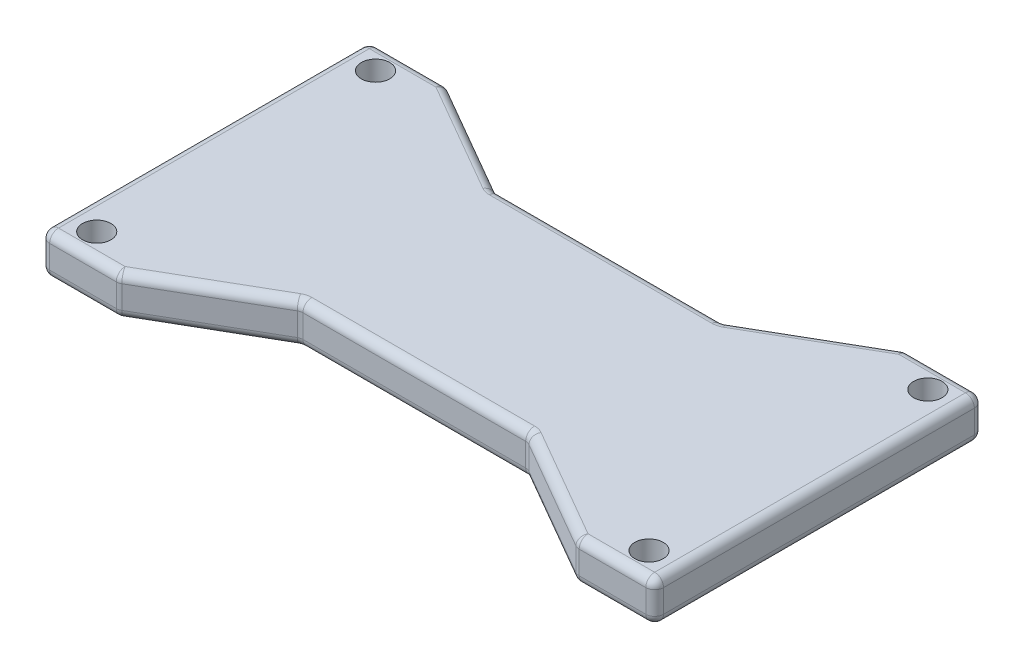
from build123d import *

# Parameters (mm, degrees)
SKETCH3_R           = 2.032000000000001
BOSS_EXTRUDE1_DEPTH = 5.842
FILLET1_R           = 1.27
CHAMFER1_SIZE       = 18.697488468
CHAMFER1_SIZE_2     = 10.795
FILLET2_R           = 1.27


with BuildPart() as part:
    # Sketch3 → Boss-Extrude1 (new body)
    with BuildSketch(Plane(origin=(0, 0, 0), x_dir=(1, 0, 0), z_dir=(0, 1, 0))):
        Polygon((44.531665591536154, -23.494999999999987), (53.467, -23.49499999999999), (53.467, 23.49499999999999), (44.531665591536154, 23.494999999999987), (44.531665591536154, 13.97), (-25.399999999999977, 13.97), (-25.399999999999977, 23.494999999999997), (-34.33533440846382, 23.494999999999997), (-34.33533440846385, -23.494999999999997), (-25.39999999999999, -23.494999999999997), (-25.39999999999999, -13.97), (44.531665591536154, -13.97), align=None)
        with Locations(Location((49.10366559153615, 19.939, 0), (0, 0, 270))):
            Circle(SKETCH3_R, mode=Mode.SUBTRACT)
        with Locations(Location((49.10366559153615, -19.939, 0), (0, 0, 90))):
            Circle(SKETCH3_R, mode=Mode.SUBTRACT)
        with Locations(Location((-29.890334408463843, -19.939000000000004, 0), (0, 0, 270))):
            Circle(SKETCH3_R, mode=Mode.SUBTRACT)
        with Locations(Location((-29.890334408463843, 19.939000000000004, 0), (0, 0, 90))):
            Circle(SKETCH3_R, mode=Mode.SUBTRACT)
    extrude(amount=BOSS_EXTRUDE1_DEPTH)

    # Fillet1
    fillet1_edges = [part.edges().sort_by_distance(p)[0] for p in [
        (-34.33533440846384, 5.842, 0),
        (53.467, 0, 0),
        (-34.33533440846384, 0, 0),
        (53.467, 2.921, -23.49499999999999),
        (53.467, 2.921, 23.49499999999999),
        (-34.33533440846385, 2.921, 23.494999999999997),
        (-34.33533440846382, 2.921, -23.494999999999997),
        (53.467, 5.842, 0),
    ]]
    fillet(fillet1_edges, radius=FILLET1_R)

    # Chamfer1
    # the kernel refuses this chamfer: 18.697488468, 10.795 mm, written as the material it adds along each edge
    with BuildSketch(Plane(origin=(-25.399999999999977, 0, -13.97), x_dir=(0.999813220622208, 0, 0.019326765612700643), z_dir=(0, 1, 0))) as chamfer1_piece_1_section:
        Polygon((CHAMFER1_SIZE * 0.999813220606, CHAMFER1_SIZE * 0.0193267656124), (-CHAMFER1_SIZE_2 * 0.0193267656127, CHAMFER1_SIZE_2 * 0.999813220622), (0, 0), align=None)
    chamfer1_piece_1 = extrude(amount=5.842, mode=Mode.PRIVATE)
    chamfer1_piece_1 = split(chamfer1_piece_1, bisect_by=Plane(origin=(-18.979428643974416, 2.920999999999999, -23.494999999999997), z_dir=(0, 0, 1)), keep=Keep.TOP, mode=Mode.PRIVATE)
    add(chamfer1_piece_1)
    with BuildSketch(Plane(origin=(44.531665591536154, 0, -13.97), x_dir=(0.05789386240267167, 0, -0.9983227437537926), z_dir=(0, 1, 0))) as chamfer1_piece_2_section:
        Polygon((CHAMFER1_SIZE_2 * 0.998322743754, CHAMFER1_SIZE_2 * 0.0578938624027), (-CHAMFER1_SIZE * 0.0578938624018, CHAMFER1_SIZE * 0.998322743738), (0, 0), align=None)
    chamfer1_piece_2 = extrude(amount=5.842, mode=Mode.PRIVATE)
    chamfer1_piece_2 = split(chamfer1_piece_2, bisect_by=Plane(origin=(38.11109423551069, 2.9210000000000003, -23.494999999999983), z_dir=(4e-16, 0, 1)), keep=Keep.TOP, mode=Mode.PRIVATE)
    add(chamfer1_piece_2)
    with BuildSketch(Plane(origin=(44.531665591536154, 0, 13.97), x_dir=(0.05789386240267167, 0, 0.9983227437537926), z_dir=(0, 1, 0))) as chamfer1_piece_3_section:
        Polygon((CHAMFER1_SIZE_2 * 0.998322743754, -CHAMFER1_SIZE_2 * 0.0578938624027), (-CHAMFER1_SIZE * 0.0578938624018, -CHAMFER1_SIZE * 0.998322743738), (0, 0), align=None)
    chamfer1_piece_3 = extrude(amount=5.842, mode=Mode.PRIVATE)
    chamfer1_piece_3 = split(chamfer1_piece_3, bisect_by=Plane(origin=(38.1110942355107, 2.921, 23.494999999999983), z_dir=(4e-16, 0, -1)), keep=Keep.TOP, mode=Mode.PRIVATE)
    add(chamfer1_piece_3)
    with BuildSketch(Plane(origin=(-25.39999999999999, 0, 13.97), x_dir=(0.999813220622208, 0, -0.019326765612700643), z_dir=(0, 1, 0))) as chamfer1_piece_4_section:
        Polygon((CHAMFER1_SIZE * 0.999813220606, -CHAMFER1_SIZE * 0.0193267656124), (-CHAMFER1_SIZE_2 * 0.0193267656127, -CHAMFER1_SIZE_2 * 0.999813220622), (0, 0), align=None)
    chamfer1_piece_4 = extrude(amount=5.842, mode=Mode.PRIVATE)
    chamfer1_piece_4 = split(chamfer1_piece_4, bisect_by=Plane(origin=(-18.979428643974433, 2.9209999999999985, 23.494999999999997), z_dir=(0, 0, -1)), keep=Keep.TOP, mode=Mode.PRIVATE)
    add(chamfer1_piece_4)

    # Fillet2
    # the kernel refuses this fillet: 1.27 mm, written as the material it adds along each edge
    with BuildSketch(Plane(origin=(25.834177123831726, 0, -13.970000000005081), x_dir=(0.8660254037845168, 0, -0.4999999999998646), z_dir=(0, 1, 0))) as fillet2_piece_1:
        with BuildLine():
            CenterArc((FILLET2_R * 0.267949192431, FILLET2_R), FILLET2_R, 240.00000000000912, 29.999999999991417)
            Line((-FILLET2_R * 0.232050807569, FILLET2_R * 0.133974596215), (0, 0))
            Line((0, 0), (FILLET2_R * 0.267949192431, 0))
        make_face()
    extrude(amount=5.842)
    with BuildSketch(Plane(origin=(-6.702511532303099, 0, -13.969999999994567), x_dir=(1.0, 0, -1.5968110012338276e-11), z_dir=(0, 1, 0))) as fillet2_piece_2:
        with BuildLine():
            CenterArc((FILLET2_R * 0.267949192447, FILLET2_R), FILLET2_R, 239.9999999991839, 29.999999999901206)
            Line((-FILLET2_R * 0.232050807565, FILLET2_R * 0.133974596223), (0, 0))
            Line((0, 0), (FILLET2_R * 0.267949192431, 0))
        make_face()
    extrude(amount=5.842)
    with BuildSketch(Plane(origin=(-6.702511532303099, 0, 13.969999999994567), x_dir=(-0.8660254037842282, 0, 0.5000000000003643), z_dir=(0, 1, 0))) as fillet2_piece_3:
        with BuildLine():
            CenterArc((FILLET2_R * 0.267949192431, FILLET2_R), FILLET2_R, 239.9999999999759, 30.000000000023817)
            Line((-FILLET2_R * 0.232050807569, FILLET2_R * 0.133974596216), (0, 0))
            Line((0, 0), (FILLET2_R * 0.267949192431, -1e-17))
        make_face()
    extrude(amount=5.842)
    with BuildSketch(Plane(origin=(25.834177123831726, 0, 13.970000000005081), x_dir=(-1.0, 0, -1.4929321554540515e-11), z_dir=(0, 1, 0))) as fillet2_piece_4:
        with BuildLine():
            CenterArc((FILLET2_R * 0.267949192416, FILLET2_R), FILLET2_R, 240.00000000074962, 30.00000000010573)
            Line((-FILLET2_R * 0.232050807573, FILLET2_R * 0.133974596209), (0, 0))
            Line((0, 0), (FILLET2_R * 0.267949192431, 0))
        make_face()
    extrude(amount=5.842)
    # the kernel refuses this fillet: 1.27 mm, written as the material it takes off along each edge
    with BuildSketch(Plane(origin=(-33.065334408463855, 4.571999999999999, 22.225), x_dir=(0, 1, 0), z_dir=(0, 0, 1))) as fillet2_2_piece_1_section:
        Polygon((0, 0), (FILLET2_R, 0), (FILLET2_R, FILLET2_R), (0, FILLET2_R), align=None)
    fillet2_2_piece_1 = extrude(amount=FILLET2_R, mode=Mode.PRIVATE)
    fillet2_2_piece_1 = fillet2_2_piece_1 - Plane(origin=(-33.065334408463855, 4.571999999999999, 22.225), x_dir=(0.7071067811865475, -0.7071067811865475, 0), z_dir=(0, 0, 1)) * Sphere(FILLET2_R, mode=Mode.PRIVATE)
    add(fillet2_2_piece_1, mode=Mode.SUBTRACT)
    with BuildSketch(Plane(origin=(-33.06533440846385, 1.27, 22.225), x_dir=(0, 0, 1), z_dir=(0, -1, 0))) as fillet2_2_piece_2_section:
        Polygon((0, 0), (FILLET2_R, 0), (FILLET2_R, FILLET2_R), (-7.7e-16, FILLET2_R), align=None)
    fillet2_2_piece_2 = extrude(amount=FILLET2_R, mode=Mode.PRIVATE)
    fillet2_2_piece_2 = fillet2_2_piece_2 - Plane(origin=(-33.06533440846385, 1.27, 22.225), x_dir=(0.7071067811865477, 0, -0.7071067811865474), z_dir=(0, -1, 0)) * Sphere(FILLET2_R, mode=Mode.PRIVATE)
    add(fillet2_2_piece_2, mode=Mode.SUBTRACT)
    with BuildSketch(Plane(origin=(-33.06533440846382, 4.571999999999999, -22.225), x_dir=(0, 0, -1), z_dir=(0, 1, 0))) as fillet2_2_piece_3_section:
        Polygon((0, 0), (FILLET2_R, 0), (FILLET2_R, FILLET2_R), (7.7e-16, FILLET2_R), align=None)
    fillet2_2_piece_3 = extrude(amount=FILLET2_R, mode=Mode.PRIVATE)
    fillet2_2_piece_3 = fillet2_2_piece_3 - Plane(origin=(-33.06533440846382, 4.571999999999999, -22.225), x_dir=(0.7071067811865472, 0, 0.7071067811865477), z_dir=(0, 1, 0)) * Sphere(FILLET2_R, mode=Mode.PRIVATE)
    add(fillet2_2_piece_3, mode=Mode.SUBTRACT)
    with BuildSketch(Plane(origin=(-33.06533440846382, 1.27, -22.225), x_dir=(0, 0, -1), z_dir=(0, -1, 0))) as fillet2_2_piece_4_section:
        Polygon((0, 0), (FILLET2_R, 0), (FILLET2_R, -FILLET2_R), (7.7e-16, -FILLET2_R), align=None)
    fillet2_2_piece_4 = extrude(amount=FILLET2_R, mode=Mode.PRIVATE)
    fillet2_2_piece_4 = fillet2_2_piece_4 - Plane(origin=(-33.06533440846382, 1.27, -22.225), x_dir=(0.7071067811865472, 0, 0.7071067811865477), z_dir=(0, -1, 0)) * Sphere(FILLET2_R, mode=Mode.PRIVATE)
    add(fillet2_2_piece_4, mode=Mode.SUBTRACT)
    with BuildSketch(Plane(origin=(52.196999999999996, 4.571999999999999, 22.225), x_dir=(0, 0, 1), z_dir=(0, 1, 0))) as fillet2_2_piece_5_section:
        Polygon((0, 0), (FILLET2_R, 0), (FILLET2_R, FILLET2_R), (0, FILLET2_R), align=None)
    fillet2_2_piece_5 = extrude(amount=FILLET2_R, mode=Mode.PRIVATE)
    fillet2_2_piece_5 = fillet2_2_piece_5 - Plane(origin=(52.196999999999996, 4.571999999999999, 22.225), x_dir=(-0.7071067811865475, 0, -0.7071067811865475), z_dir=(0, 1, 0)) * Sphere(FILLET2_R, mode=Mode.PRIVATE)
    add(fillet2_2_piece_5, mode=Mode.SUBTRACT)
    with BuildSketch(Plane(origin=(52.196999999999996, 1.27, 22.225), x_dir=(0, 0, 1), z_dir=(0, -1, 0))) as fillet2_2_piece_6_section:
        Polygon((0, 0), (FILLET2_R, 0), (FILLET2_R, -FILLET2_R), (0, -FILLET2_R), align=None)
    fillet2_2_piece_6 = extrude(amount=FILLET2_R, mode=Mode.PRIVATE)
    fillet2_2_piece_6 = fillet2_2_piece_6 - Plane(origin=(52.196999999999996, 1.27, 22.225), x_dir=(-0.7071067811865475, 0, -0.7071067811865475), z_dir=(0, -1, 0)) * Sphere(FILLET2_R, mode=Mode.PRIVATE)
    add(fillet2_2_piece_6, mode=Mode.SUBTRACT)
    with BuildSketch(Plane(origin=(52.196999999999996, 4.571999999999999, -22.225), x_dir=(0, 0, -1), z_dir=(0, 1, 0))) as fillet2_2_piece_7_section:
        Polygon((0, 0), (FILLET2_R, 0), (FILLET2_R, -FILLET2_R), (0, -FILLET2_R), align=None)
    fillet2_2_piece_7 = extrude(amount=FILLET2_R, mode=Mode.PRIVATE)
    fillet2_2_piece_7 = fillet2_2_piece_7 - Plane(origin=(52.196999999999996, 4.571999999999999, -22.225), x_dir=(-0.7071067811865475, 0, 0.7071067811865475), z_dir=(0, 1, 0)) * Sphere(FILLET2_R, mode=Mode.PRIVATE)
    add(fillet2_2_piece_7, mode=Mode.SUBTRACT)
    with BuildSketch(Plane(origin=(52.196999999999996, 1.27, -22.225), x_dir=(0, 0, -1), z_dir=(0, -1, 0))) as fillet2_2_piece_8_section:
        Polygon((0, 0), (FILLET2_R, 0), (FILLET2_R, FILLET2_R), (0, FILLET2_R), align=None)
    fillet2_2_piece_8 = extrude(amount=FILLET2_R, mode=Mode.PRIVATE)
    fillet2_2_piece_8 = fillet2_2_piece_8 - Plane(origin=(52.196999999999996, 1.27, -22.225), x_dir=(-0.7071067811865475, 0, 0.7071067811865475), z_dir=(0, -1, 0)) * Sphere(FILLET2_R, mode=Mode.PRIVATE)
    add(fillet2_2_piece_8, mode=Mode.SUBTRACT)
    with BuildSketch(Plane(origin=(42.67225654030955, 1.27, 22.224999999999998), x_dir=(0, 0, 1), z_dir=(0, -1, 0))) as fillet2_2_piece_9_section:
        Polygon((0, 0), (FILLET2_R, 0), (FILLET2_R, FILLET2_R * 0.267949192431), (FILLET2_R * 0.866025403785, FILLET2_R * 0.5), align=None)
    fillet2_2_piece_9 = extrude(amount=FILLET2_R, mode=Mode.PRIVATE)
    fillet2_2_piece_9 = fillet2_2_piece_9 - Plane(origin=(42.67225654030955, 1.27, 22.224999999999998), x_dir=(0.2588190451024496, 0, -0.9659258262890873), z_dir=(0, -1, 0)) * Sphere(FILLET2_R, mode=Mode.PRIVATE)
    add(fillet2_2_piece_9, mode=Mode.SUBTRACT)
    with BuildSketch(Plane(origin=(-23.54059094877809, 1.27, -22.225), x_dir=(0, 0, -1), z_dir=(0, -1, 0))) as fillet2_2_piece_10_section:
        Polygon((0, 0), (FILLET2_R, 0), (FILLET2_R, FILLET2_R * 0.267949192431), (FILLET2_R * 0.866025403784, FILLET2_R * 0.5), align=None)
    fillet2_2_piece_10 = extrude(amount=FILLET2_R, mode=Mode.PRIVATE)
    fillet2_2_piece_10 = fillet2_2_piece_10 - Plane(origin=(-23.54059094877809, 1.27, -22.225), x_dir=(-0.2588190451027209, 0, 0.9659258262890146), z_dir=(0, -1, 0)) * Sphere(FILLET2_R, mode=Mode.PRIVATE)
    add(fillet2_2_piece_10, mode=Mode.SUBTRACT)
    with BuildSketch(Plane(origin=(42.67225654030955, 4.571999999999999, 22.224999999999998), x_dir=(0, 0, 1), z_dir=(0, 1, 0))) as fillet2_2_piece_11_section:
        Polygon((0, 0), (FILLET2_R, 0), (FILLET2_R, -FILLET2_R * 0.267949192431), (FILLET2_R * 0.866025403785, -FILLET2_R * 0.5), align=None)
    fillet2_2_piece_11 = extrude(amount=FILLET2_R, mode=Mode.PRIVATE)
    fillet2_2_piece_11 = fillet2_2_piece_11 - Plane(origin=(42.67225654030955, 4.571999999999999, 22.224999999999998), x_dir=(0.2588190451024496, 0, -0.9659258262890873), z_dir=(0, 1, 0)) * Sphere(FILLET2_R, mode=Mode.PRIVATE)
    add(fillet2_2_piece_11, mode=Mode.SUBTRACT)
    with BuildSketch(Plane(origin=(42.67225654030955, 1.27, -22.225000000000016), x_dir=(0, 0, -1), z_dir=(0, -1, 0))) as fillet2_2_piece_12_section:
        Polygon((0, 0), (FILLET2_R, 0), (FILLET2_R, -FILLET2_R * 0.267949192431), (FILLET2_R * 0.866025403785, -FILLET2_R * 0.5), align=None)
    fillet2_2_piece_12 = extrude(amount=FILLET2_R, mode=Mode.PRIVATE)
    fillet2_2_piece_12 = fillet2_2_piece_12 - Plane(origin=(42.67225654030955, 1.27, -22.225000000000016), x_dir=(0.2588190451024496, 0, 0.9659258262890873), z_dir=(0, -1, 0)) * Sphere(FILLET2_R, mode=Mode.PRIVATE)
    add(fillet2_2_piece_12, mode=Mode.SUBTRACT)
    with BuildSketch(Plane(origin=(42.67225654030953, 4.571999999999999, -22.225), x_dir=(-0.4999999999998724, 0, -0.8660254037845124), z_dir=(0, 1, 0))) as fillet2_2_piece_13_section:
        Polygon((0, 0), (FILLET2_R, 3e-17), (FILLET2_R, -FILLET2_R * 0.267949192431), (FILLET2_R * 0.866025403785, -FILLET2_R * 0.5), align=None)
    fillet2_2_piece_13 = extrude(amount=FILLET2_R, mode=Mode.PRIVATE)
    fillet2_2_piece_13 = fillet2_2_piece_13 - Plane(origin=(42.67225654030953, 4.571999999999999, -22.225), x_dir=(0.2588190451024496, 0, 0.9659258262890873), z_dir=(0, 1, 0)) * Sphere(FILLET2_R, mode=Mode.PRIVATE)
    add(fillet2_2_piece_13, mode=Mode.SUBTRACT)
    with BuildSketch(Plane(origin=(-23.54059094877809, 1.27, 22.225), x_dir=(0, 0, 1), z_dir=(0, -1, 0))) as fillet2_2_piece_14_section:
        Polygon((0, 0), (FILLET2_R, 0), (FILLET2_R, -FILLET2_R * 0.267949192431), (FILLET2_R * 0.866025403784, -FILLET2_R * 0.5), align=None)
    fillet2_2_piece_14 = extrude(amount=FILLET2_R, mode=Mode.PRIVATE)
    fillet2_2_piece_14 = fillet2_2_piece_14 - Plane(origin=(-23.54059094877809, 1.27, 22.225), x_dir=(-0.2588190451027209, 0, -0.9659258262890146), z_dir=(0, -1, 0)) * Sphere(FILLET2_R, mode=Mode.PRIVATE)
    add(fillet2_2_piece_14, mode=Mode.SUBTRACT)
    with BuildSketch(Plane(origin=(-23.54059094877809, 4.571999999999999, 22.225), x_dir=(0.5000000000003589, 0, 0.8660254037842315), z_dir=(0, 1, 0))) as fillet2_2_piece_15_section:
        Polygon((0, 0), (FILLET2_R, 2e-17), (FILLET2_R, -FILLET2_R * 0.267949192431), (FILLET2_R * 0.866025403784, -FILLET2_R * 0.5), align=None)
    fillet2_2_piece_15 = extrude(amount=FILLET2_R, mode=Mode.PRIVATE)
    fillet2_2_piece_15 = fillet2_2_piece_15 - Plane(origin=(-23.54059094877809, 4.571999999999999, 22.225), x_dir=(-0.2588190451027209, 0, -0.9659258262890146), z_dir=(0, 1, 0)) * Sphere(FILLET2_R, mode=Mode.PRIVATE)
    add(fillet2_2_piece_15, mode=Mode.SUBTRACT)
    with BuildSketch(Plane(origin=(-23.540590948778096, 4.571999999999999, -22.225000000000016), x_dir=(0, 0, -1), z_dir=(0, 1, 0))) as fillet2_2_piece_16_section:
        Polygon((0, 0), (FILLET2_R, 0), (FILLET2_R, -FILLET2_R * 0.267949192431), (FILLET2_R * 0.866025403784, -FILLET2_R * 0.5), align=None)
    fillet2_2_piece_16 = extrude(amount=FILLET2_R, mode=Mode.PRIVATE)
    fillet2_2_piece_16 = fillet2_2_piece_16 - Plane(origin=(-23.540590948778096, 4.571999999999999, -22.225000000000016), x_dir=(-0.2588190451027209, 0, 0.9659258262890146), z_dir=(0, 1, 0)) * Sphere(FILLET2_R, mode=Mode.PRIVATE)
    add(fillet2_2_piece_16, mode=Mode.SUBTRACT)
    with BuildSketch(Plane(origin=(52.196999999999996, -2.2e-16, 23.49499999999999), x_dir=(-1.08e-15, 1.7e-16, -1), z_dir=(-1, 2e-17, 1.08e-15))) as fillet2_2_piece_17:
        with BuildLine():
            CenterArc((FILLET2_R, -FILLET2_R), FILLET2_R, 90.00000000000001, 89.99999999999999)
            Line((3.77e-15, -FILLET2_R), (0, 0))
            Line((0, 0), (FILLET2_R, 0))
        make_face()
    extrude(amount=9.524743459690463, mode=Mode.SUBTRACT)
    with BuildSketch(Plane(origin=(-33.06533440846382, -2.2e-16, -23.494999999999997), x_dir=(0, 1.7e-16, 1), z_dir=(1, 2e-17, 0))) as fillet2_2_piece_18:
        with BuildLine():
            CenterArc((FILLET2_R, -FILLET2_R), FILLET2_R, 90.00000000000001, 89.99999999999999)
            Line((-1.044e-14, -FILLET2_R), (0, 0))
            Line((0, 0), (FILLET2_R, 0))
        make_face()
    extrude(amount=9.52474345968573, mode=Mode.SUBTRACT)
    with BuildSketch(Plane(origin=(42.67225654030953, 5.842, 23.495), x_dir=(-1.08e-15, -7e-16, -1), z_dir=(1, 0, -1.08e-15))) as fillet2_2_piece_19:
        with BuildLine():
            CenterArc((FILLET2_R, -FILLET2_R), FILLET2_R, 90.00000000000004, 89.99999999999996)
            Line((4.44e-15, -FILLET2_R), (0, 0))
            Line((0, 0), (FILLET2_R, 0))
        make_face()
    extrude(amount=9.524743459690463, mode=Mode.SUBTRACT)
    with BuildSketch(Plane(origin=(42.67225654030953, -1e-17, -23.495), x_dir=(-1.08e-15, 1e-17, 1), z_dir=(1, -2e-17, 1.08e-15))) as fillet2_2_piece_20:
        with BuildLine():
            CenterArc((FILLET2_R, -FILLET2_R), FILLET2_R, 90, 90)
            Line((-1.42e-14, -FILLET2_R), (0, 0))
            Line((0, 0), (FILLET2_R, 0))
        make_face()
    extrude(amount=9.524743459690463, mode=Mode.SUBTRACT)
    with BuildSketch(Plane(origin=(52.196999999999996, 5.842, -23.49499999999999), x_dir=(-1.08e-15, -7e-16, 1), z_dir=(-1, 0, -1.08e-15))) as fillet2_2_piece_21:
        with BuildLine():
            CenterArc((FILLET2_R, -FILLET2_R), FILLET2_R, 90.00000000000004, 89.99999999999996)
            Line((-9.77e-15, -FILLET2_R), (0, 0))
            Line((0, 0), (FILLET2_R, 0))
        make_face()
    extrude(amount=9.524743459690477, mode=Mode.SUBTRACT)
    with BuildSketch(Plane(origin=(-23.540590948778085, -1e-17, 23.494999999999997), x_dir=(0, 1e-17, -1), z_dir=(-1, -2e-17, 0))) as fillet2_2_piece_22:
        with BuildLine():
            CenterArc((FILLET2_R, -FILLET2_R), FILLET2_R, 90, 90)
            Line((3.56e-15, -FILLET2_R), (0, 0))
            Line((0, 0), (FILLET2_R, 0))
        make_face()
    extrude(amount=9.524743459685762, mode=Mode.SUBTRACT)
    with BuildSketch(Plane(origin=(-23.54059094877809, 5.842, 23.494999999999997), x_dir=(-9e-17, -1, 2.8e-15), z_dir=(-1, 9e-17, 0))) as fillet2_2_piece_23:
        with BuildLine():
            CenterArc((FILLET2_R, -FILLET2_R), FILLET2_R, 89.99999999999984, 90.00000000000028)
            Line((-4.44e-15, -FILLET2_R), (0, 0))
            Line((0, 0), (FILLET2_R, 0))
        make_face()
    extrude(amount=9.524743459685759, mode=Mode.SUBTRACT)
    with BuildSketch(Plane(origin=(25.4938816494443, 0, -13.97), x_dir=(0, 0, 1), z_dir=(-1, 0, 0))) as fillet2_2_piece_24:
        with BuildLine():
            CenterArc((FILLET2_R, FILLET2_R), FILLET2_R, 180, 90)
            Line((-8.88e-15, FILLET2_R), (0, 0))
            Line((0, 0), (FILLET2_R, 0))
        make_face()
    extrude(amount=31.85609770735959, mode=Mode.SUBTRACT)
    with BuildSketch(Plane(origin=(25.4938816494443, 5.842, -13.97), x_dir=(0, -7e-16, 1), z_dir=(-1, 0, 0))) as fillet2_2_piece_25:
        with BuildLine():
            CenterArc((FILLET2_R, -FILLET2_R), FILLET2_R, 90.00000000000004, 89.99999999999996)
            Line((-7.99e-15, -FILLET2_R), (0, 0))
            Line((0, 0), (FILLET2_R, 0))
        make_face()
    extrude(amount=31.85609770735959, mode=Mode.SUBTRACT)
    with BuildSketch(Plane(origin=(-6.36221605791529, 0, 13.97), x_dir=(0, 0, -1), z_dir=(1, 0, 0))) as fillet2_2_piece_26:
        with BuildLine():
            CenterArc((FILLET2_R, FILLET2_R), FILLET2_R, 180, 90)
            Line((1.78e-15, FILLET2_R), (0, 0))
            Line((0, 0), (FILLET2_R, 0))
        make_face()
    extrude(amount=31.856097707359595, mode=Mode.SUBTRACT)
    with BuildSketch(Plane(origin=(-6.36221605791529, 5.842, 13.97), x_dir=(0, -7e-16, -1), z_dir=(1, 0, 0))) as fillet2_2_piece_27:
        with BuildLine():
            CenterArc((FILLET2_R, -FILLET2_R), FILLET2_R, 90.00000000000004, 89.99999999999996)
            Line((2.66e-15, -FILLET2_R), (0, 0))
            Line((0, 0), (FILLET2_R, 0))
        make_face()
    extrude(amount=31.856097707359595, mode=Mode.SUBTRACT)
    with BuildSketch(Plane(origin=(-23.200295474390288, 1.2700000000000002, -23.495000000000005), x_dir=(-1, 0, 1.044e-14), z_dir=(0, 1, 0))) as fillet2_2_piece_28:
        with BuildLine():
            CenterArc((FILLET2_R * 0.267949192431, FILLET2_R), FILLET2_R, 239.999999999976, 30.00000000002342)
            Line((-FILLET2_R * 0.232050807569, FILLET2_R * 0.133974596216), (0, 0))
            Line((0, 0), (FILLET2_R * 0.267949192431, 0))
        make_face()
    extrude(amount=3.3019999999999987, mode=Mode.SUBTRACT)
    with BuildSketch(Plane(origin=(-6.997216057915747, 0, -14.140147737188592), x_dir=(-0.5000000000003588, 0, 0.8660254037842313), z_dir=(-0.8660254037842315, 0, -0.5000000000003589))) as fillet2_2_piece_29:
        with BuildLine():
            CenterArc((FILLET2_R, FILLET2_R), FILLET2_R, 180, 90)
            Line((-8.82e-15, FILLET2_R), (0, 0))
            Line((0, 0), (FILLET2_R, 0))
        make_face()
    extrude(amount=18.369409051221574, mode=Mode.SUBTRACT)
    with BuildSketch(Plane(origin=(-33.06533440846382, 5.8420000000000005, -23.494999999999997), x_dir=(0, -1.4e-15, 1), z_dir=(1, -9e-17, 0))) as fillet2_2_piece_30:
        with BuildLine():
            CenterArc((FILLET2_R, FILLET2_R), FILLET2_R, 180, 89.99999999999989)
            Line((-8.88e-15, FILLET2_R), (0, 0))
            Line((0, 0), (FILLET2_R, 0))
        make_face()
    extrude(amount=9.524743459685723, mode=Mode.SUBTRACT)
    with BuildSketch(Plane(origin=(-6.997216057915747, 5.842, -14.140147737188592), x_dir=(-0.5000000000003588, 0, 0.8660254037842313), z_dir=(-0.8660254037842315, 0, -0.5000000000003589))) as fillet2_2_piece_31:
        with BuildLine():
            CenterArc((FILLET2_R, -FILLET2_R), FILLET2_R, 90.00000000000004, 89.99999999999996)
            Line((-7.93e-15, -FILLET2_R), (0, 0))
            Line((0, 0), (FILLET2_R, 0))
        make_face()
    extrude(amount=18.369409051221584, mode=Mode.SUBTRACT)
    with BuildSketch(Plane(origin=(42.0372565403097, 0, -23.324852262806335), x_dir=(0.4999999999998724, 0, 0.8660254037845124), z_dir=(-0.8660254037845124, 0, 0.4999999999998724))) as fillet2_2_piece_32:
        with BuildLine():
            CenterArc((FILLET2_R, FILLET2_R), FILLET2_R, 180, 90)
            Line((-6.63e-15, FILLET2_R), (0, 0))
            Line((0, 0), (FILLET2_R, 0))
        make_face()
    extrude(amount=18.369409051219872, mode=Mode.SUBTRACT)
    with BuildSketch(Plane(origin=(42.33196106592211, 4.571999999999999, -23.495), x_dir=(-0.8660254037845145, 0, 0.4999999999998685), z_dir=(0, -1, 0))) as fillet2_2_piece_33:
        with BuildLine():
            CenterArc((FILLET2_R * 0.267949192431, -FILLET2_R), FILLET2_R, 89.99999999999993, 29.999999999991388)
            Line((-FILLET2_R * 0.232050807569, -FILLET2_R * 0.133974596215), (0, 0))
            Line((0, 0), (FILLET2_R * 0.267949192431, 0))
        make_face()
    extrude(amount=3.3019999999999996, mode=Mode.SUBTRACT)
    with BuildSketch(Plane(origin=(42.03725654030968, 5.842, -23.324852262806324), x_dir=(0.4999999999998724, 0, 0.8660254037845123), z_dir=(-0.8660254037845124, 0, 0.4999999999998724))) as fillet2_2_piece_34:
        with BuildLine():
            CenterArc((FILLET2_R, -FILLET2_R), FILLET2_R, 90.00000000000004, 89.99999999999996)
            Line((-2.66e-15, -FILLET2_R), (0, 0))
            Line((0, 0), (FILLET2_R, 0))
        make_face()
    extrude(amount=18.369409051219847, mode=Mode.SUBTRACT)
    with BuildSketch(Plane(origin=(42.33196106592211, 4.571999999999999, 23.495), x_dir=(1, 0, 0), z_dir=(0, -1, 0))) as fillet2_2_piece_35:
        with BuildLine():
            CenterArc((FILLET2_R * 0.267949192431, -FILLET2_R), FILLET2_R, 90, 29.99999999999136)
            Line((-FILLET2_R * 0.232050807569, -FILLET2_R * 0.133974596215), (0, 0))
            Line((0, 0), (FILLET2_R * 0.267949192431, 0))
        make_face()
    extrude(amount=3.3019999999999996, mode=Mode.SUBTRACT)
    with BuildSketch(Plane(origin=(42.03725654030969, 0, 23.32485226280633), x_dir=(0.4999999999998724, 0, -0.8660254037845123), z_dir=(-0.8660254037845124, 0, -0.4999999999998724))) as fillet2_2_piece_36:
        with BuildLine():
            CenterArc((FILLET2_R, -FILLET2_R), FILLET2_R, 90, 90)
            Line((1.278e-14, -FILLET2_R), (0, 0))
            Line((0, 0), (FILLET2_R, 0))
        make_face()
    extrude(amount=18.369409051219865, mode=Mode.SUBTRACT)
    with BuildSketch(Plane(origin=(42.03725654030969, 5.842, 23.32485226280633), x_dir=(0.4999999999998724, 0, -0.8660254037845123), z_dir=(-0.8660254037845124, 0, -0.4999999999998724))) as fillet2_2_piece_37:
        with BuildLine():
            CenterArc((FILLET2_R, FILLET2_R), FILLET2_R, 180, 89.99999999999994)
            Line((1.367e-14, FILLET2_R), (0, 0))
            Line((0, 0), (FILLET2_R, 0))
        make_face()
    extrude(amount=18.369409051219865, mode=Mode.SUBTRACT)
    with BuildSketch(Plane(origin=(-6.997216057915747, 0, 14.140147737188594), x_dir=(-6.1e-16, 1, -1.05e-15), z_dir=(-0.8660254037842315, 0, 0.5000000000003589))) as fillet2_2_piece_38:
        with BuildLine():
            CenterArc((FILLET2_R, FILLET2_R), FILLET2_R, 179.99999999999986, 90.00000000000006)
            Line((1.32e-15, FILLET2_R), (0, 0))
            Line((0, 0), (FILLET2_R, 0))
        make_face()
    extrude(amount=18.369409051221577, mode=Mode.SUBTRACT)
    with BuildSketch(Plane(origin=(-23.200295474390288, 1.2700000000000002, 23.495000000000005), x_dir=(0.8660254037842348, 0, -0.5000000000003532), z_dir=(0, 1, 0))) as fillet2_2_piece_39:
        with BuildLine():
            CenterArc((FILLET2_R * 0.267949192431, FILLET2_R), FILLET2_R, 239.9999999999768, 30.00000000002359)
            Line((-FILLET2_R * 0.232050807569, FILLET2_R * 0.133974596216), (0, 0))
            Line((0, 0), (FILLET2_R * 0.267949192431, 0))
        make_face()
    extrude(amount=3.3019999999999987, mode=Mode.SUBTRACT)
    with BuildSketch(Plane(origin=(-6.997216057915747, 5.842, 14.140147737188594), x_dir=(-6.1e-16, -1, -1.05e-15), z_dir=(-0.8660254037842315, 0, 0.5000000000003589))) as fillet2_2_piece_40:
        with BuildLine():
            CenterArc((FILLET2_R, -FILLET2_R), FILLET2_R, 90.00000000000007, 90.00000000000006)
            Line((6.5e-16, -FILLET2_R), (0, 0))
            Line((0, 0), (FILLET2_R, 0))
        make_face()
    extrude(amount=18.369409051221577, mode=Mode.SUBTRACT)
    with BuildSketch(Plane(origin=(-6.36221605791529, 5.842, 15.239999999994568), x_dir=(-0.5000000000003596, 0, -0.866025403784231), z_dir=(-0.866025403784231, 0, 0.5000000000003596))) as fillet2_2_piece_41:
        with BuildLine():
            CenterArc((1.2699999999999994 + FILLET2_R, FILLET2_R), FILLET2_R, 180.00000000000003, 90)
            Line((1.2700000000000014, FILLET2_R), (1.2699999999999994, 0))
            Line((1.2699999999999994, 0), (1.2699999999999994 + FILLET2_R, 8.9e-16))
        make_face()
    revolve(axis=Axis((-6.36221605791529, 5.842, 15.239999999994568), (0, -1, 0)), revolution_arc=30.00000000002379, mode=Mode.SUBTRACT)
    with BuildSketch(Plane(origin=(-6.36221605791529, 0, 15.239999999994568), x_dir=(-0.5000000000003596, 0, -0.866025403784231), z_dir=(-0.866025403784231, 0, 0.5000000000003596))) as fillet2_2_piece_42:
        with BuildLine():
            CenterArc((1.2699999999999994 + FILLET2_R, -FILLET2_R), FILLET2_R, 90, 90)
            Line((1.2700000000000014, -FILLET2_R), (1.2699999999999994, 0))
            Line((1.2699999999999994, 0), (1.2699999999999994 + FILLET2_R, 0))
        make_face()
    revolve(axis=Axis((-6.36221605791529, 0, 15.239999999994568), (0, -1, 0)), revolution_arc=30.00000000002379, mode=Mode.SUBTRACT)
    with BuildSketch(Plane(origin=(25.493881649444305, 5.842, 15.24), x_dir=(0, 0, -1), z_dir=(-1, 0, 0))) as fillet2_2_piece_43:
        with BuildLine():
            CenterArc((1.2699999999999996 + FILLET2_R, FILLET2_R), FILLET2_R, 180.00000000000003, 90)
            Line((1.2700000000000014, FILLET2_R), (1.2699999999999996, 0))
            Line((1.2699999999999996, 0), (1.2699999999999996 + FILLET2_R, 8.9e-16))
        make_face()
    revolve(axis=Axis((25.493881649444305, 5.842, 15.24), (0, -1, 0)), revolution_arc=30.000000000105764, mode=Mode.SUBTRACT)
    with BuildSketch(Plane(origin=(25.493881649444305, 0, 15.24), x_dir=(0, 0, -1), z_dir=(-1, 0, 0))) as fillet2_2_piece_44:
        with BuildLine():
            CenterArc((1.2699999999999996 + FILLET2_R, -FILLET2_R), FILLET2_R, 90, 90)
            Line((1.2700000000000014, -FILLET2_R), (1.2699999999999996, 0))
            Line((1.2699999999999996, 0), (1.2699999999999996 + FILLET2_R, 0))
        make_face()
    revolve(axis=Axis((25.493881649444305, 0, 15.24), (0, -1, 0)), revolution_arc=30.000000000105764, mode=Mode.SUBTRACT)
    with BuildSketch(Plane(origin=(25.493881649444297, 5.842, -15.240000000005075), x_dir=(0.4999999999998728, 0, 0.8660254037845121), z_dir=(0.8660254037845121, 0, -0.4999999999998728))) as fillet2_2_piece_45:
        with BuildLine():
            CenterArc((1.2699999999999994 + FILLET2_R, FILLET2_R), FILLET2_R, 180.00000000000003, 90)
            Line((1.269999999999998, FILLET2_R), (1.2699999999999994, 0))
            Line((1.2699999999999994, 0), (1.2699999999999994 + FILLET2_R, 8.9e-16))
        make_face()
    revolve(axis=Axis((25.493881649444297, 5.842, -15.240000000005075), (0, -1, 0)), revolution_arc=29.99999999999143, mode=Mode.SUBTRACT)
    with BuildSketch(Plane(origin=(25.493881649444297, 0, -15.240000000005075), x_dir=(0.4999999999998728, 0, 0.8660254037845121), z_dir=(0.8660254037845121, 0, -0.4999999999998728))) as fillet2_2_piece_46:
        with BuildLine():
            CenterArc((1.2699999999999994 + FILLET2_R, -FILLET2_R), FILLET2_R, 90, 90)
            Line((1.269999999999998, -FILLET2_R), (1.2699999999999994, 0))
            Line((1.2699999999999994, 0), (1.2699999999999994 + FILLET2_R, 0))
        make_face()
    revolve(axis=Axis((25.493881649444297, 0, -15.240000000005075), (0, -1, 0)), revolution_arc=29.99999999999143, mode=Mode.SUBTRACT)
    with BuildSketch(Plane(origin=(-6.36221605791529, 5.842, -15.24), x_dir=(0, 0, 1), z_dir=(1, 0, 0))) as fillet2_2_piece_47:
        with BuildLine():
            CenterArc((1.2699999999999996 + FILLET2_R, FILLET2_R), FILLET2_R, 180.00000000000003, 90)
            Line((1.2699999999999907, FILLET2_R), (1.2699999999999996, 0))
            Line((1.2699999999999996, 0), (1.2699999999999996 + FILLET2_R, 8.9e-16))
        make_face()
    revolve(axis=Axis((-6.36221605791529, 5.842, -15.24), (0, -1, 0)), revolution_arc=29.999999999901217, mode=Mode.SUBTRACT)
    with BuildSketch(Plane(origin=(-6.36221605791529, 0, -15.24), x_dir=(0, 0, 1), z_dir=(1, 0, 0))) as fillet2_2_piece_48:
        with BuildLine():
            CenterArc((1.2699999999999996 + FILLET2_R, -FILLET2_R), FILLET2_R, 90, 90)
            Line((1.2699999999999907, -FILLET2_R), (1.2699999999999996, 0))
            Line((1.2699999999999996, 0), (1.2699999999999996 + FILLET2_R, 0))
        make_face()
    revolve(axis=Axis((-6.36221605791529, 0, -15.24), (0, -1, 0)), revolution_arc=29.999999999901217, mode=Mode.SUBTRACT)


solid = part.part
